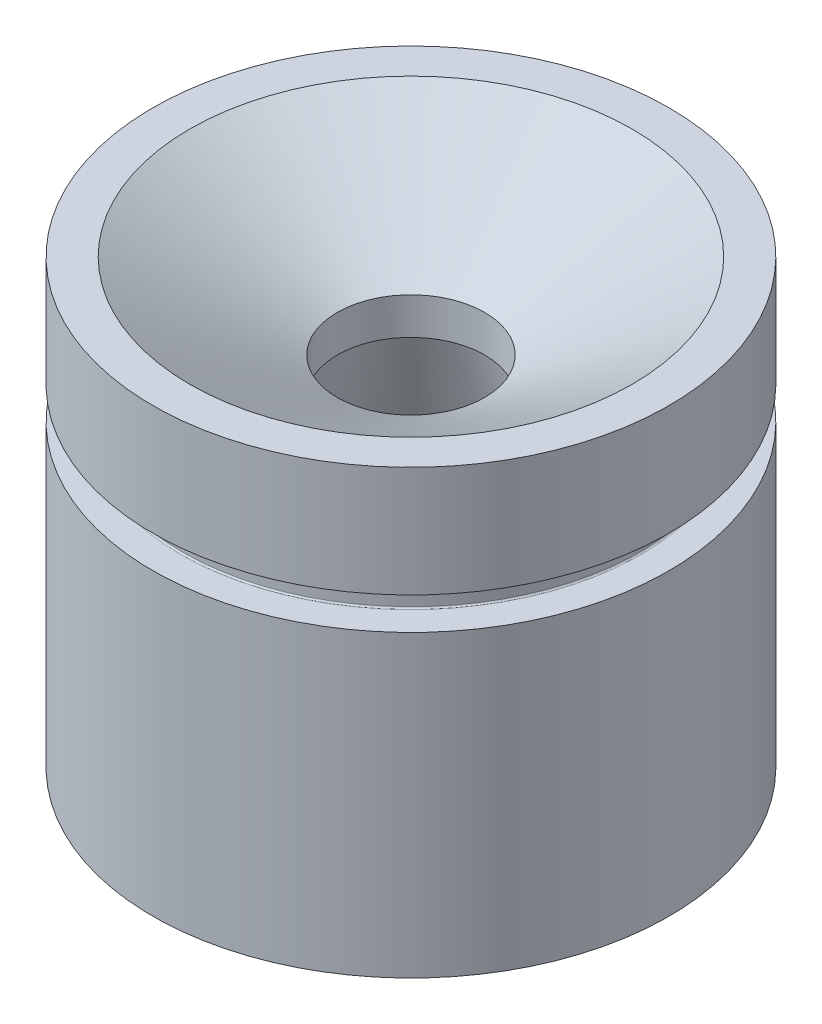
from build123d import *


with BuildPart() as part:
    # Sketch1 → Revolve1 (revolve)
    with BuildSketch(Plane.XY):
        Polygon((-44.45, 0), (-44.45, 76.2), (-38.1, 76.2), (-12.7, 61.535303163), (-12.7, 55.185303163), (-28.321, 0), align=None)
    revolve(axis=Axis((0, 0, 0), (0, 1, 0)))

    # Sketch2 → Cut-Revolve1 (revolve, cut)
    with BuildSketch(Plane.XY):
        with BuildLine():
            Line((-44.45, 57.15), (-39.624, 57.15))
            ThreePointArc((-39.624, 57.15), (-39.444394878, 57.075605122), (-39.37, 56.896))
            Line((-39.37, 56.896), (-39.37, 51.816))
            ThreePointArc((-39.37, 51.816), (-39.444394878, 51.636394878), (-39.624, 51.562))
            Line((-39.624, 51.562), (-44.45, 51.562))
            Line((-44.45, 51.562), (-44.45, 57.15))
        make_face()
    revolve(axis=Axis((0, 0, 0), (0, 1, 0)), mode=Mode.SUBTRACT)


solid = part.part
